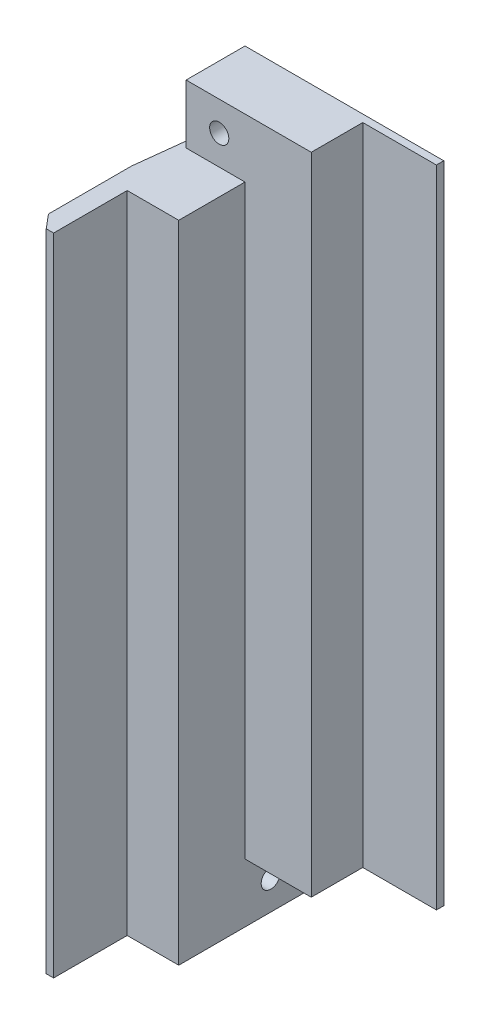
from build123d import *

# Parameters (mm, degrees)
STOCK_GOUX_START         = -23.909074226
STOCK_GOUX_LIKED_1_DEPTH = 47.818148452
SKETCH2_W                = 9.499999796
SKETCH2_H                = 4
CUT_EXTRUDE1_DEPTH       = 126.862368241
SKETCH4_R                = 0.64999997
CUT_EXTRUDE2_DEPTH       = 126.862368241
CIRPATTERN1_COUNT        = 2
CUT_EXTRUDE3_DEPTH       = 0.4
BOSS_EXTRUDE1_DEPTH      = 43.818148451


# Read off the part's stored shape, not the designer's step: Stock-Goux Liked-1
with BuildPart() as part:
    # Stock-Goux Liked-1 outline → Stock-Goux Liked-1 (new body)
    with BuildSketch(Plane(origin=(0, 0, 0), x_dir=(1, 0, 0), z_dir=(0, 1, 0)).offset(STOCK_GOUX_START)):
        Polygon((118.20487789, -113.704878), (118.20487789, -110.204877888), (123.204877796, -110.204877888), (123.204877796, -109.704877872), (109.704877872, -109.704877872), (109.704877872, -123.204877796), (110.204877888, -123.204877796), (110.204877888, -118.20487789), (113.704878, -118.20487789), (113.704878, -113.704878), align=None)
    extrude(amount=STOCK_GOUX_LIKED_1_DEPTH)

    # Sketch2 → Cut-Extrude1 (cut, through all)
    with BuildSketch(Plane.XY.offset(113.704878)):
        with Locations((118.454877898, -21.909074226)):
            Rectangle(SKETCH2_W, SKETCH2_H)
    cut_extrude1 = extrude(amount=-CUT_EXTRUDE1_DEPTH, mode=Mode.SUBTRACT)

    # Sketch4 → Cut-Extrude2 (cut, through all)
    with BuildSketch(Plane(origin=(113.704878, 0, 0), x_dir=(0, 0, -1), z_dir=(1, 0, 0))):
        with Locations((-111.954877944, -21.909074226)):
            Circle(SKETCH4_R)
    cut_extrude2 = extrude(amount=-CUT_EXTRUDE2_DEPTH, mode=Mode.SUBTRACT)

    # CirPattern1: Cut-Extrude1, Cut-Extrude2 ×2 about axis
    cirpattern1_axis = Axis((109.279877871, 0, 109.279877871), (0.7071067811865481, 0, 0.707106781186547))
    add([cut_extrude1.rotate(cirpattern1_axis, i * 360 / CIRPATTERN1_COUNT) for i in range(1, CIRPATTERN1_COUNT)], mode=Mode.SUBTRACT)
    add([cut_extrude2.rotate(cirpattern1_axis, i * 360 / CIRPATTERN1_COUNT) for i in range(1, CIRPATTERN1_COUNT)], mode=Mode.SUBTRACT)

    # Sketch5 → Cut-Extrude3 (cut)
    # profile 1 of 2: a face of its own
    with BuildSketch(Plane(origin=(0, 0, 109.704877872), x_dir=(-1, 0, 0), z_dir=(0, 0, -1))):
        with BuildLine():
            Line((-115.502816358, 2.577164082), (-115.958204979, 2.893900861))
            Line((-115.958204979, 2.893900861), (-114.192620044, 5.474860396))
            add(Edge.make_bspline(
                [(-114.192620044, 5.474860396), (-114.305270378, 5.46108441), (-114.527085168, 5.433958724), (-114.750491053, 5.428975508), (-114.860438553, 5.426523056)],
                knots=[0, 0, 0, 0, 1.015715272, 2, 2, 2, 2], degree=3))
            add(Edge.make_bspline(
                [(-114.860438553, 5.426523056), (-114.927099126, 5.428230438), (-115.057948, 5.431581878), (-115.250319712, 5.458146302), (-115.435169229, 5.499058677), (-115.61200649, 5.560107132), (-115.781496163, 5.635977312), (-115.943268243, 5.730060751), (-116.097104958, 5.840743594), (-116.241354116, 5.967440593), (-116.372548271, 6.106556488), (-116.48943054, 6.253796012), (-116.586569451, 6.410869558), (-116.667262684, 6.574572957), (-116.728459364, 6.747259122), (-116.773022825, 6.926963034), (-116.800459097, 7.114944155), (-116.80372317, 7.242896893), (-116.80538046, 7.3078632)],
                knots=[0, 0, 0, 0, 1.060718605, 2.082097864, 3.085795603, 4.069760067, 5.054557537, 6.03741023, 7.043284206, 8.066802108, 9.088538119, 10.083643548, 11.053783639, 12.022749082, 12.983451788, 13.964007469, 14.966251758, 16, 16, 16, 16], degree=3))
            add(Edge.make_bspline(
                [(-116.80538046, 7.3078632), (-116.8022337, 7.396706327), (-116.796057248, 7.571087363), (-116.746348509, 7.825874344), (-116.66459618, 8.066787073), (-116.550607553, 8.293192139), (-116.407034559, 8.501832709), (-116.234480402, 8.689808329), (-116.033994639, 8.854445421), (-115.810144404, 8.995967104), (-115.568203923, 9.109786313), (-115.314805072, 9.193677615), (-115.051889454, 9.243023915), (-114.873785253, 9.249529692), (-114.784116438, 9.252805107)],
                knots=[0, 0, 0, 0, 1.022988612, 2.007919123, 2.978103895, 3.94594894, 4.918897164, 5.887013414, 6.875921846, 7.89917871, 8.930658928, 9.948724884, 10.967259574, 12, 12, 12, 12], degree=3))
            add(Edge.make_bspline(
                [(-114.784116438, 9.252805107), (-114.696144591, 9.249484669), (-114.522320513, 9.242923795), (-114.266707601, 9.194874308), (-114.021886042, 9.11389063), (-113.789212994, 9.001977207), (-113.573785775, 8.861694989), (-113.380063946, 8.694536639), (-113.212468325, 8.50039804), (-113.07127357, 8.283974636), (-112.957935069, 8.051443113), (-112.876161069, 7.808720854), (-112.825822553, 7.557553459), (-112.819479217, 7.387383485), (-112.816277896, 7.301503024)],
                knots=[0, 0, 0, 0, 1.026385292, 2.028040595, 3.023318987, 4.028184125, 5.03290303, 6.015178782, 7.004435299, 8.016004309, 9.023023918, 10.015172535, 10.998308025, 12, 12, 12, 12], degree=3))
            add(Edge.make_bspline(
                [(-112.816277896, 7.301503024), (-112.818415867, 7.234839332), (-112.822752205, 7.099628708), (-112.853116648, 6.894196515), (-112.904678984, 6.684734999), (-112.96319278, 6.507440104), (-113.019675427, 6.361011916), (-113.072836052, 6.245348335), (-113.131822387, 6.123607472), (-113.200617862, 5.997065873), (-113.274572315, 5.864110417), (-113.358137002, 5.726074632), (-113.449405682, 5.582773288), (-113.514411031, 5.486167857), (-113.547698169, 5.436699338)],
                knots=[0, 0, 0, 0, 1.179839688, 2.393009684, 3.667231171, 4.993948276, 5.694988576, 6.444077775, 7.246288328, 8.089075292, 8.993003841, 9.939041771, 10.944649915, 12, 12, 12, 12], degree=3))
            Line((-113.547698169, 5.436699338), (-115.502816358, 2.577164082))
        make_face()
        with BuildLine():
            add(Edge.make_bspline(
                [(-114.754859627, 6.077805107), (-114.704360773, 6.079184661), (-114.606056671, 6.081870182), (-114.462043571, 6.098215521), (-114.32610966, 6.127196896), (-114.197891822, 6.168779802), (-114.076104442, 6.218956901), (-113.962681961, 6.282841505), (-113.857529453, 6.359071685), (-113.759942786, 6.444724142), (-113.673285243, 6.539884487), (-113.59610003, 6.639483523), (-113.530494429, 6.743958458), (-113.478672484, 6.854617663), (-113.436064754, 6.968767455), (-113.406640647, 7.088246071), (-113.390340499, 7.212431027), (-113.387561785, 7.296792878), (-113.386149691, 7.339664082)],
                knots=[0, 0, 0, 0, 1.163407946, 2.26475976, 3.333800367, 4.359385343, 5.366239384, 6.363380779, 7.350133999, 8.353570782, 9.349036268, 10.310270964, 11.253520213, 12.184142, 13.120487599, 14.056272588, 15.012232024, 16, 16, 16, 16], degree=3))
            add(Edge.make_bspline(
                [(-113.386149691, 7.339664082), (-113.387364662, 7.382553189), (-113.389758912, 7.467071435), (-113.408967299, 7.591440248), (-113.442758775, 7.710626593), (-113.488098654, 7.825282973), (-113.547825371, 7.934467362), (-113.619495981, 8.039550558), (-113.704644854, 8.139866276), (-113.802620939, 8.233055217), (-113.908275056, 8.318957834), (-114.020870535, 8.394769715), (-114.139479312, 8.458308171), (-114.263377772, 8.510739159), (-114.392824062, 8.551654524), (-114.527741583, 8.581077457), (-114.668812105, 8.597354783), (-114.764572438, 8.600115935), (-114.813373249, 8.601523056)],
                knots=[0, 0, 0, 0, 0.972161553, 1.915763587, 2.844109794, 3.775983486, 4.705125789, 5.659731448, 6.655561913, 7.682237399, 8.721216875, 9.739758359, 10.754845918, 11.767244016, 12.7857855, 13.828538656, 14.893392813, 16, 16, 16, 16], degree=3))
            add(Edge.make_bspline(
                [(-114.813373249, 8.601523056), (-114.861749641, 8.600113661), (-114.956663725, 8.597348441), (-115.096480128, 8.581108397), (-115.23048539, 8.551456647), (-115.359556615, 8.510758112), (-115.483451394, 8.45830426), (-115.602054576, 8.394766386), (-115.714676392, 8.318975285), (-115.820229214, 8.232987627), (-115.918378301, 8.14030004), (-116.00206319, 8.039111105), (-116.073897823, 7.934522025), (-116.133542471, 7.825268446), (-116.17890418, 7.71063047), (-116.212689812, 7.591439198), (-116.231899769, 7.467071708), (-116.234293803, 7.382553281), (-116.235508665, 7.339664082)],
                knots=[0, 0, 0, 0, 1.099389452, 2.15699305, 3.192601482, 4.213358962, 5.227959689, 6.245255729, 7.266013209, 8.307253147, 9.336162325, 10.327954924, 11.284637477, 12.215801273, 13.149702402, 14.080068371, 15.025723358, 16, 16, 16, 16], degree=3))
            add(Edge.make_bspline(
                [(-116.235508665, 7.339664082), (-116.234409342, 7.296759493), (-116.232241276, 7.21214379), (-116.211326572, 7.087817334), (-116.176350264, 6.968640183), (-116.129506512, 6.853453528), (-116.067817913, 6.743377443), (-115.992118932, 6.638933801), (-115.903390298, 6.538938627), (-115.802818114, 6.444945542), (-115.692748736, 6.35867231), (-115.575188925, 6.283324331), (-115.452162507, 6.219692896), (-115.323236405, 6.168636385), (-115.189366068, 6.127612367), (-115.04934833, 6.098268935), (-114.903646242, 6.082026965), (-114.804930989, 6.079225895), (-114.754859627, 6.077805107)],
                knots=[0, 0, 0, 0, 0.952633368, 1.87876736, 2.791047057, 3.707742249, 4.635551637, 5.587206343, 6.568248508, 7.601284464, 8.641511608, 9.671105535, 10.699146789, 11.713763218, 12.747829548, 13.806491675, 14.887386225, 16, 16, 16, 16], degree=3))
        make_face(mode=Mode.SUBTRACT)
    # profile 2 of 2: a face of its own
    with BuildSketch(Plane(origin=(0, 0, 109.704877872), x_dir=(-1, 0, 0), z_dir=(0, 0, -1))):
        with BuildLine():
            add(Edge.make_bspline(
                [(-110.984547127, 3.716907671), (-110.949186313, 3.714806426), (-110.879865572, 3.710687181), (-110.779646011, 3.682426644), (-110.688941414, 3.632245931), (-110.608147199, 3.565366319), (-110.541551163, 3.484275616), (-110.489582124, 3.394294467), (-110.461567765, 3.293235864), (-110.457478525, 3.223513453), (-110.45538046, 3.187741005)],
                knots=[0, 0, 0, 0, 1.020151414, 1.999887582, 2.974338812, 3.990962822, 5.007586832, 5.987933904, 6.967670073, 8, 8, 8, 8], degree=3))
            add(Edge.make_bspline(
                [(-110.45538046, 3.187741005), (-110.457549622, 3.152828107), (-110.461827176, 3.083980384), (-110.489517908, 2.983684016), (-110.541947227, 2.893646632), (-110.607687857, 2.81145561), (-110.688961387, 2.744434316), (-110.779860451, 2.694680534), (-110.879630305, 2.664396513), (-110.949147063, 2.660538803), (-110.984547127, 2.658574338)],
                knots=[0, 0, 0, 0, 1.009421747, 1.99056486, 2.972319754, 3.999869655, 5.017953583, 5.993804169, 6.978383603, 8, 8, 8, 8], degree=3))
            add(Edge.make_bspline(
                [(-110.984547127, 2.658574338), (-111.019972699, 2.660467722), (-111.089132694, 2.664164102), (-111.188530141, 2.695302336), (-111.279982784, 2.743967757), (-111.361240489, 2.811580579), (-111.427531716, 2.893223696), (-111.477652054, 2.984304098), (-111.507751324, 3.083693277), (-111.511709865, 3.152771558), (-111.513713794, 3.187741005)],
                knots=[0, 0, 0, 0, 1.022052826, 1.995314843, 2.982371812, 4.00089066, 5.028879526, 6.005146991, 6.990147033, 8, 8, 8, 8], degree=3))
            add(Edge.make_bspline(
                [(-111.513713794, 3.187741005), (-111.511786842, 3.223572022), (-111.508024706, 3.293527686), (-111.477588865, 3.393674638), (-111.427920595, 3.484694521), (-111.360782235, 3.565242602), (-111.280002441, 3.632710994), (-111.188750755, 3.681814262), (-111.088893303, 3.710916152), (-111.019932415, 3.714875861), (-110.984547127, 3.716907671)],
                knots=[0, 0, 0, 0, 1.032775665, 2.016367738, 2.991239715, 4.008302682, 5.025365648, 6.011011707, 6.979408107, 8, 8, 8, 8], degree=3))
        make_face()
    extrude(amount=-CUT_EXTRUDE3_DEPTH, mode=Mode.SUBTRACT)

    # Sketch6 → Boss-Extrude1 (add)
    with BuildSketch(Plane.XZ.offset(23.909074226)):
        Polygon((109.704877872, 109.704877872), (108.911127872, 116.61737789), (108.911127872, 122.258923382), (109.704877872, 123.204877796), align=None)
    extrude(amount=-BOSS_EXTRUDE1_DEPTH)


solid = part.part
